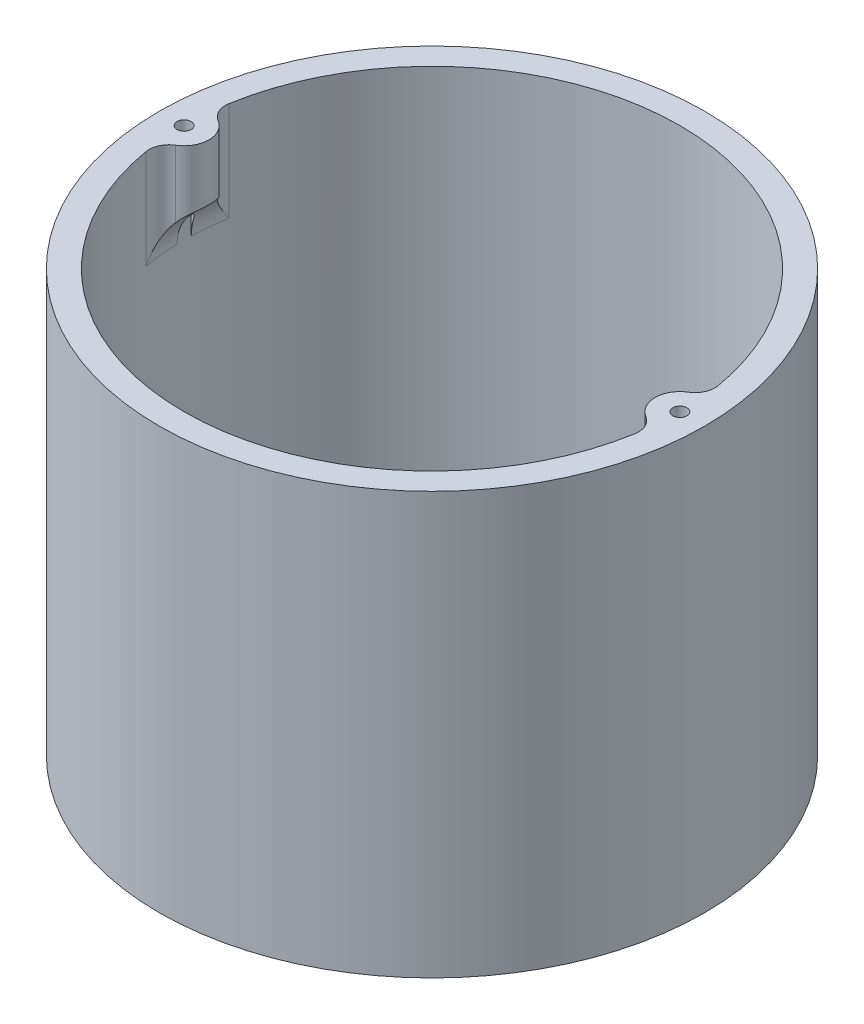
from build123d import *
from build123d.topology import SkipClean

# Parameters (mm, degrees)
SKETCH2_R               = 3.175
SKETCH2_R_2             = 0.9
BOSS_EXTRUDE1_DEPTH     = 6.35
CUT_EXTRUDE1_DEPTH      = 6.35
FILLET1_R               = 2.54
FILLET2_START           = -7.200738553
FILLET2_DEPTH           = 0.850738553
FILLET2_START_2         = -12.7000001
FILLET2_2_DEPTH         = 5.499261547
CUT_EXTRUDE2_DEPTH      = 74.162913344
CUT_EXTRUDE2_DEPTH_BACK = 74.162913344
SKETCH4_W               = 34.925
SKETCH4_H               = 69.85


with BuildPart() as part:
    # Sketch1 → Revolve1 (revolve)
    with BuildSketch(Plane.XY, mode=Mode.PRIVATE) as revolve1_sk:
        Polygon((0, -50.8), (-31.75, -50.8), (-31.75, 0), (-34.925, 0), (-34.925, -53.975), (0, -53.975), align=None)
    revolve(revolve1_sk.sketch.rotate(Axis((0, -53.975, 0), (0, 1, 0)), 180), axis=Axis((0, -53.975, 0), (0, 1, 0)))

    # Sketch2 → Boss-Extrude1 (add)
    with BuildSketch(Plane(origin=(0, 0, 0), x_dir=(1, 0, 0), z_dir=(0, 1, 0))):
        with Locations((-31.75, 0)):
            Circle(SKETCH2_R)
        with Locations((-31.75, 0)):
            Circle(SKETCH2_R_2, mode=Mode.SUBTRACT)
    extrude(amount=-BOSS_EXTRUDE1_DEPTH)

    # Sketch3 → Cut-Extrude1 (cut)
    with BuildSketch(Plane(origin=(0, 0, 0), x_dir=(1, 0, 0), z_dir=(0, 1, 0))):
        with BuildLine():
            ThreePointArc((-31.737244094, -0.899909599), (-30.85, 0), (-31.737244094, 0.899909599))
            ThreePointArc((-31.737244094, 0.899909599), (-32.65, 0), (-31.737244094, -0.899909599))
        make_face()
    extrude(amount=-CUT_EXTRUDE1_DEPTH, mode=Mode.SUBTRACT)

    # Fillet1
    fillet1_edges = [part.edges().sort_by_distance(p)[0] for p in [
        (-31.59125, -3.175, -3.171028766),
        (-31.59125, -3.175, 3.171028766),
    ]]
    fillet(fillet1_edges, radius=FILLET1_R)

    # Fillet2: read off the stored shape, not the designer's step
    # Fillet2 outline → Fillet2 (add)
    with BuildSketch(Plane(origin=(0, 0, 0), x_dir=(1, 0, 0), z_dir=(0, 1, 0)).offset(FILLET2_START)):
        with BuildLine():
            ThreePointArc((-31.737244094, 0.899909599), (-30.85, 0), (-31.737244094, -0.899909599))
            ThreePointArc((-31.737244094, -0.899909599), (-31.59663833, -3.116880855), (-31.301358696, -5.318594157))
            ThreePointArc((-31.301358696, -5.318594157), (-31.106269167, -3.834791697), (-30.109583333, -2.718392569))
            ThreePointArc((-30.109583333, -2.718392569), (-28.575, 0), (-30.109583333, 2.718392569))
            ThreePointArc((-30.109583333, 2.718392569), (-31.106269167, 3.834791697), (-31.301358696, 5.318594157))
            ThreePointArc((-31.301358696, 5.318594157), (-31.59663833, 3.116880855), (-31.737244094, 0.899909599))
        make_face()
    extrude(amount=FILLET2_DEPTH)

    # Fillet2 2 outline → Fillet2 2 (add)
    with BuildSketch(Plane(origin=(0, 0, 0), x_dir=(1, 0, 0), z_dir=(0, 1, 0)).offset(FILLET2_START_2)):
        with BuildLine():
            ThreePointArc((-31.737244094, 0.899909599), (-30.85, 0), (-31.737244094, -0.899909599))
            ThreePointArc((-31.737244094, -0.899909599), (-31.59663833, -3.116880855), (-31.301358695, -5.318594158))
            ThreePointArc((-31.301358695, -5.318594158), (-31.106269167, -3.834791697), (-30.109583333, -2.718392569))
            ThreePointArc((-30.109583333, -2.718392569), (-28.575, 0), (-30.109583333, 2.718392569))
            ThreePointArc((-30.109583333, 2.718392569), (-31.106269167, 3.834791697), (-31.301358696, 5.318594157))
            ThreePointArc((-31.301358696, 5.318594157), (-31.59663833, 3.116880854), (-31.737244094, 0.899909599))
        make_face()
    extrude(amount=FILLET2_2_DEPTH)

    # Fillet2 3 outline → Fillet2 3 (revolve, cut)
    with BuildSketch(Plane.XY):
        with BuildLine():
            Line((28.575, -12.7000001), (31.75, -12.7))
            ThreePointArc((31.75, -12.7), (30.899261314, -9.525), (28.575, -7.200738685))
            Line((28.575, -7.200738685), (28.575, -12.7000001))
        make_face()
    revolve(axis=Axis((0, 0, 0), (0, 1, 0)), mode=Mode.SUBTRACT)

    # Sketch4 → Cut-Extrude2 (cut, two sides: drawn at the far end of the back side and taken through both)
    with BuildSketch(Plane(origin=(0, 0, 0), x_dir=(1, 0, 0), z_dir=(0, 1, 0)).offset(-CUT_EXTRUDE2_DEPTH_BACK)):
        with Locations((17.4625, 0)):
            Rectangle(SKETCH4_W, SKETCH4_H)
    extrude(amount=CUT_EXTRUDE2_DEPTH + CUT_EXTRUDE2_DEPTH_BACK, mode=Mode.SUBTRACT)

    # Mirror1: part across plane


with BuildPart() as part_1:
    with SkipClean():  # the faces are left unmerged after this step: merging them gives an invalid solid
        add(part.part)
        add(part.part.mirror(Plane(origin=(0, -53.975, 34.925), x_dir=(0, 0, 1), z_dir=(-1, 0, 0))))


solid = part_1.part
